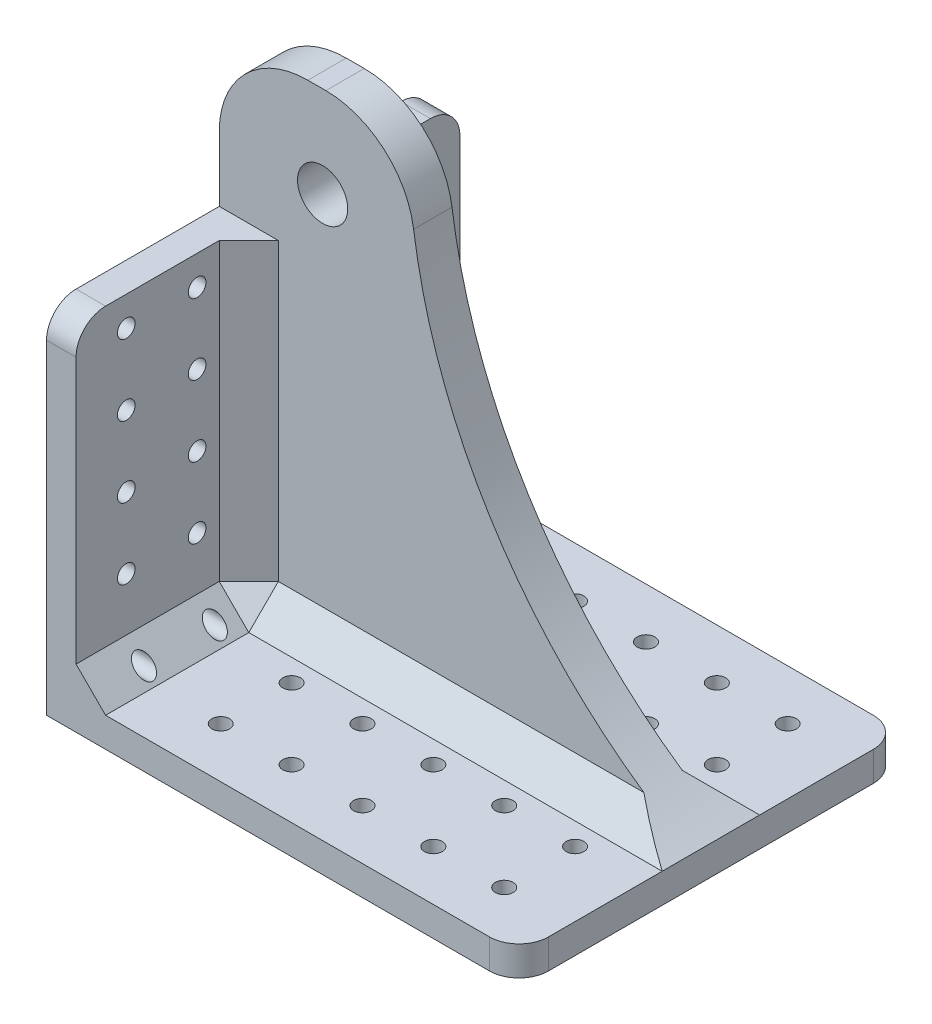
from build123d import *

# Parameters (mm, degrees)
BOSS_EXTRU_1_DEPTH           = 65
ESQUISSE2_W                  = 80
ESQUISSE2_H                  = 6.5
BOSS_EXTRU_2_DEPTH           = 81
ENL_V_MAT_EXTRU_1_DEPTH      = 123.776473724
ENL_V_MAT_EXTRU_1_DEPTH_BACK = 123.776473724
CONG_1_R                     = 15
ENL_V_MAT_EXTRU_2_DEPTH      = 123.776473724
ENL_V_MAT_EXTRU_2_DEPTH_BACK = 123.776473724
ESQUISSE4_R                  = 4.25
CHANFREIN1_SIZE              = 5
ENL_V_MAT_EXTRU_3_DEPTH      = 135.242318216
ENL_V_MAT_EXTRU_3_DEPTH_BACK = 135.242318216
ESQUISSE5_R                  = 1.5
CONG_2_R                     = 5
ENL_V_MAT_EXTRU_4_DEPTH      = 135.242318216
ENL_V_MAT_EXTRU_4_DEPTH_BACK = 135.242318216
ESQUISSE6_R                  = 1.5


with BuildPart() as part:
    # Esquisse1 → Boss.-Extru.1 (new body)
    with BuildSketch(Plane.XY):
        Polygon((0, 0), (80, 0), (80, 5), (5, 5), (5, 60), (0, 60), align=None)
    extrude(amount=BOSS_EXTRU_1_DEPTH)

    # Esquisse2 → Boss.-Extru.2 (add)
    with BuildSketch(Plane(origin=(0, 5, 0), x_dir=(1, 0, 0), z_dir=(0, 1, 0))):
        with Locations((40, -32.5)):
            Rectangle(ESQUISSE2_W, ESQUISSE2_H)
    extrude(amount=BOSS_EXTRU_2_DEPTH)

    # Esquisse3 → Enlèv. mat.-Extru.1 (cut, two sides: drawn at the far end of the back side and taken through both)
    with BuildSketch(Plane.XY.offset(35.75).offset(-ENL_V_MAT_EXTRU_1_DEPTH_BACK)):
        with BuildLine():
            Line((32, 86), (80, 86))
            Line((80, 86), (80, 5))
            ThreePointArc((80, 5), (44.901203691, 38.922935521), (32, 86))
        make_face()
    extrude(amount=ENL_V_MAT_EXTRU_1_DEPTH + ENL_V_MAT_EXTRU_1_DEPTH_BACK, mode=Mode.SUBTRACT)

    # Congé1
    cong_1_edges = [part.edges().sort_by_distance(p)[0] for p in [
        (0, 86, 32.5),
        (32, 86, 32.5),
    ]]
    fillet(cong_1_edges, radius=CONG_1_R)

    # Esquisse4 → Enlèv. mat.-Extru.2 (cut, two sides: drawn at the far end of the back side and taken through both)
    with BuildSketch(Plane.XY.offset(35.75).offset(-ENL_V_MAT_EXTRU_2_DEPTH_BACK)):
        with Locations((17.5, 70.5)):
            Circle(ESQUISSE4_R)
    extrude(amount=ENL_V_MAT_EXTRU_2_DEPTH + ENL_V_MAT_EXTRU_2_DEPTH_BACK, mode=Mode.SUBTRACT)

    # Chanfrein1
    # the kernel refuses this chamfer: 5 mm, written as the material it adds along each edge
    with BuildSketch(Plane(origin=(8.333333333, 8.333333333, 39.083333333), x_dir=(0, 0.7071067811865474, -0.7071067811865476), z_dir=(-0.5773502691896261, -0.5773502691896257, -0.5773502691896255))) as chanfrein1_piece_1_section:
        Polygon((-3.535533906, 2.041241452), (3.535533906, 2.041241452), (0, -4.082482905), align=None)
    chanfrein1_piece_1 = extrude(amount=6.350852961, mode=Mode.PRIVATE)
    chanfrein1_piece_1 = split(chanfrein1_piece_1, bisect_by=Plane(origin=(5, 5, 35.75), z_dir=(0, 1, 0)), keep=Keep.TOP, mode=Mode.PRIVATE)
    chanfrein1_piece_1 = split(chanfrein1_piece_1, bisect_by=Plane(origin=(5, 5, 35.75), z_dir=(0, 0, 1)), keep=Keep.TOP, mode=Mode.PRIVATE)
    chanfrein1_piece_1 = split(chanfrein1_piece_1, bisect_by=Plane(origin=(5, 5, 35.75), z_dir=(1, 0, 0)), keep=Keep.TOP, mode=Mode.PRIVATE)
    add(chanfrein1_piece_1)
    with BuildSketch(Plane(origin=(8.333333333, 8.333333333, 25.916666667), x_dir=(0, -0.7071067811865474, -0.7071067811865476), z_dir=(-0.577350269189626, -0.5773502691896256, 0.5773502691896257))) as chanfrein1_piece_2_section:
        Polygon((-3.535533906, 2.041241452), (3.535533906, 2.041241452), (0, -4.082482905), align=None)
    chanfrein1_piece_2 = extrude(amount=6.350852961, mode=Mode.PRIVATE)
    chanfrein1_piece_2 = split(chanfrein1_piece_2, bisect_by=Plane(origin=(5, 5, 29.25), z_dir=(0, 0, -1)), keep=Keep.TOP, mode=Mode.PRIVATE)
    chanfrein1_piece_2 = split(chanfrein1_piece_2, bisect_by=Plane(origin=(5, 5, 29.25), z_dir=(0, 1, 0)), keep=Keep.TOP, mode=Mode.PRIVATE)
    chanfrein1_piece_2 = split(chanfrein1_piece_2, bisect_by=Plane(origin=(5, 5, 29.25), z_dir=(1, 0, 0)), keep=Keep.TOP, mode=Mode.PRIVATE)
    add(chanfrein1_piece_2)
    with BuildSketch(Plane(origin=(5, 5, 22.89158506), x_dir=(-0.027495876610586324, 0.9996219169112968, 0), z_dir=(0, 0, 1))) as chanfrein1_piece_3:
        Polygon((CHANFREIN1_SIZE * 0.999621916911, -CHANFREIN1_SIZE * 0.0274958766106), (-CHANFREIN1_SIZE * 0.0274958766106, -CHANFREIN1_SIZE * 0.999621916911), (0, 0), align=None)
    extrude(amount=42.10841494)
    with BuildSketch(Plane(origin=(5, 5, 0), x_dir=(0.9996219169112968, -0.02749587661058617, 0), z_dir=(0, 0, 1))) as chanfrein1_piece_4:
        Polygon((CHANFREIN1_SIZE * 0.999621916911, CHANFREIN1_SIZE * 0.0274958766106), (-CHANFREIN1_SIZE * 0.0274958766106, CHANFREIN1_SIZE * 0.999621916911), (0, 0), align=None)
    extrude(amount=42.10841494)
    with BuildSketch(Plane(origin=(5, 5, 35.75), x_dir=(0.9996219169112968, 0, -0.027495876610586327), z_dir=(0, 1, 0)), Plane(origin=(5, 60, 29.25), x_dir=(0.9996219169112968, 0, 0.027495876610586313), z_dir=(0, -1, 0))) as chanfrein1_piece_5:
        Polygon((CHANFREIN1_SIZE * 0.999621916911, -CHANFREIN1_SIZE * 0.0274958766106), (-CHANFREIN1_SIZE * 0.0274958766106, -CHANFREIN1_SIZE * 0.999621916911), (0, 0), align=None)
    extrude(amount=55)
    with BuildSketch(Plane(origin=(92.85841494, 5, 35.75), x_dir=(0, 0.9996219169112968, -0.027495876610586327), z_dir=(-1, 0, 0))) as chanfrein1_piece_6_section:
        Polygon((CHANFREIN1_SIZE * 0.999621916911, -CHANFREIN1_SIZE * 0.0274958766106), (-CHANFREIN1_SIZE * 0.0274958766106, -CHANFREIN1_SIZE * 0.999621916911), (0, 0), align=None)
    chanfrein1_piece_6 = extrude(amount=87.85841494, mode=Mode.PRIVATE)
    chanfrein1_piece_6 = chanfrein1_piece_6 - Plane(origin=(124.34375, 86, 37.432610037), x_dir=(-0.4802030456852788, -0.8771573604060916, 0), z_dir=(0, 0, -1)) * Cylinder(92.34375, 196, mode=Mode.PRIVATE)
    add(chanfrein1_piece_6)
    with BuildSketch(Plane(origin=(5, 5, 29.25), x_dir=(0, 0.9996219169112968, 0.027495876610586324), z_dir=(1, 0, 0))) as chanfrein1_piece_7_section:
        Polygon((CHANFREIN1_SIZE * 0.999621916911, -CHANFREIN1_SIZE * 0.0274958766106), (-CHANFREIN1_SIZE * 0.0274958766106, -CHANFREIN1_SIZE * 0.999621916911), (0, 0), align=None)
    chanfrein1_piece_7 = extrude(amount=87.85841494, mode=Mode.PRIVATE)
    chanfrein1_piece_7 = chanfrein1_piece_7 - Plane(origin=(124.34375, 86, 27.567389963), x_dir=(-0.4802030456852788, -0.8771573604060916, 0), z_dir=(0, 0, -1)) * Cylinder(92.34375, 196, mode=Mode.PRIVATE)
    add(chanfrein1_piece_7)

    # Esquisse5 → Enlèv. mat.-Extru.3 (cut, two sides: drawn at the far end of the back side and taken through both)
    with BuildSketch(Plane.ZY.offset(-ENL_V_MAT_EXTRU_3_DEPTH_BACK)):
        with Locations(Location((8.5, 55, 0), (0, 0, 270))):
            Circle(ESQUISSE5_R)
        with Locations(Location((8.5, 43, 0), (0, 0, 270))):
            Circle(ESQUISSE5_R)
        with Locations(Location((8.5, 31, 0), (0, 0, 270))):
            Circle(ESQUISSE5_R)
        with Locations(Location((20.5, 31, 0), (0, 0, 270))):
            Circle(ESQUISSE5_R)
        with Locations(Location((20.5, 43, 0), (0, 0, 270))):
            Circle(ESQUISSE5_R)
        with Locations(Location((20.5, 55, 0), (0, 0, 270))):
            Circle(ESQUISSE5_R)
        with Locations(Location((20.5, 7, 0), (0, 0, 90))):
            Circle(ESQUISSE5_R)
        with Locations(Location((20.5, 19, 0), (0, 0, 270))):
            Circle(ESQUISSE5_R)
        with Locations(Location((8.5, 19, 0), (0, 0, 270))):
            Circle(ESQUISSE5_R)
        with Locations(Location((8.5, 7, 0), (0, 0, 90))):
            Circle(ESQUISSE5_R)
        with Locations(Location((56.5, 7, 0), (0, 0, 90))):
            Circle(ESQUISSE5_R)
        with Locations(Location((56.5, 19, 0), (0, 0, 270))):
            Circle(ESQUISSE5_R)
        with Locations(Location((44.5, 19, 0), (0, 0, 270))):
            Circle(ESQUISSE5_R)
        with Locations(Location((44.5, 7, 0), (0, 0, 90))):
            Circle(ESQUISSE5_R)
        with Locations(Location((44.5, 55, 0), (0, 0, 270))):
            Circle(ESQUISSE5_R)
        with Locations(Location((44.5, 43, 0), (0, 0, 270))):
            Circle(ESQUISSE5_R)
        with Locations(Location((44.5, 31, 0), (0, 0, 270))):
            Circle(ESQUISSE5_R)
        with Locations(Location((56.5, 31, 0), (0, 0, 270))):
            Circle(ESQUISSE5_R)
        with Locations(Location((56.5, 43, 0), (0, 0, 270))):
            Circle(ESQUISSE5_R)
        with Locations(Location((56.5, 55, 0), (0, 0, 270))):
            Circle(ESQUISSE5_R)
    extrude(amount=ENL_V_MAT_EXTRU_3_DEPTH + ENL_V_MAT_EXTRU_3_DEPTH_BACK, mode=Mode.SUBTRACT)

    # Congé2
    cong_2_edges = [part.edges().sort_by_distance(p)[0] for p in [
        (80, 2.5, 65),
        (2.5, 60, 65),
        (2.5, 60, 0),
        (80, 2.5, 0),
    ]]
    fillet(cong_2_edges, radius=CONG_2_R)

    # Esquisse6 → Enlèv. mat.-Extru.4 (cut, two sides: drawn at the far end of the back side and taken through both)
    with BuildSketch(Plane.XZ.offset(-ENL_V_MAT_EXTRU_4_DEPTH_BACK)):
        with Locations((45, 56.5)):
            Circle(ESQUISSE6_R)
        with Locations((57, 56.5)):
            Circle(ESQUISSE6_R)
        with Locations((69, 56.5)):
            Circle(ESQUISSE6_R)
        with Locations((21, 56.5)):
            Circle(ESQUISSE6_R)
        with Locations((33, 56.5)):
            Circle(ESQUISSE6_R)
        with Locations((33, 44.5)):
            Circle(ESQUISSE6_R)
        with Locations((21, 44.5)):
            Circle(ESQUISSE6_R)
        with Locations((69, 44.5)):
            Circle(ESQUISSE6_R)
        with Locations((57, 44.5)):
            Circle(ESQUISSE6_R)
        with Locations((45, 44.5)):
            Circle(ESQUISSE6_R)
        with Locations((45, 20.5)):
            Circle(ESQUISSE6_R)
        with Locations((57, 20.5)):
            Circle(ESQUISSE6_R)
        with Locations((69, 20.5)):
            Circle(ESQUISSE6_R)
        with Locations((21, 20.5)):
            Circle(ESQUISSE6_R)
        with Locations((33, 20.5)):
            Circle(ESQUISSE6_R)
        with Locations((33, 8.5)):
            Circle(ESQUISSE6_R)
        with Locations((21, 8.5)):
            Circle(ESQUISSE6_R)
        with Locations((69, 8.5)):
            Circle(ESQUISSE6_R)
        with Locations((57, 8.5)):
            Circle(ESQUISSE6_R)
        with Locations((45, 8.5)):
            Circle(ESQUISSE6_R)
    extrude(amount=ENL_V_MAT_EXTRU_4_DEPTH + ENL_V_MAT_EXTRU_4_DEPTH_BACK, mode=Mode.SUBTRACT)


solid = part.part
